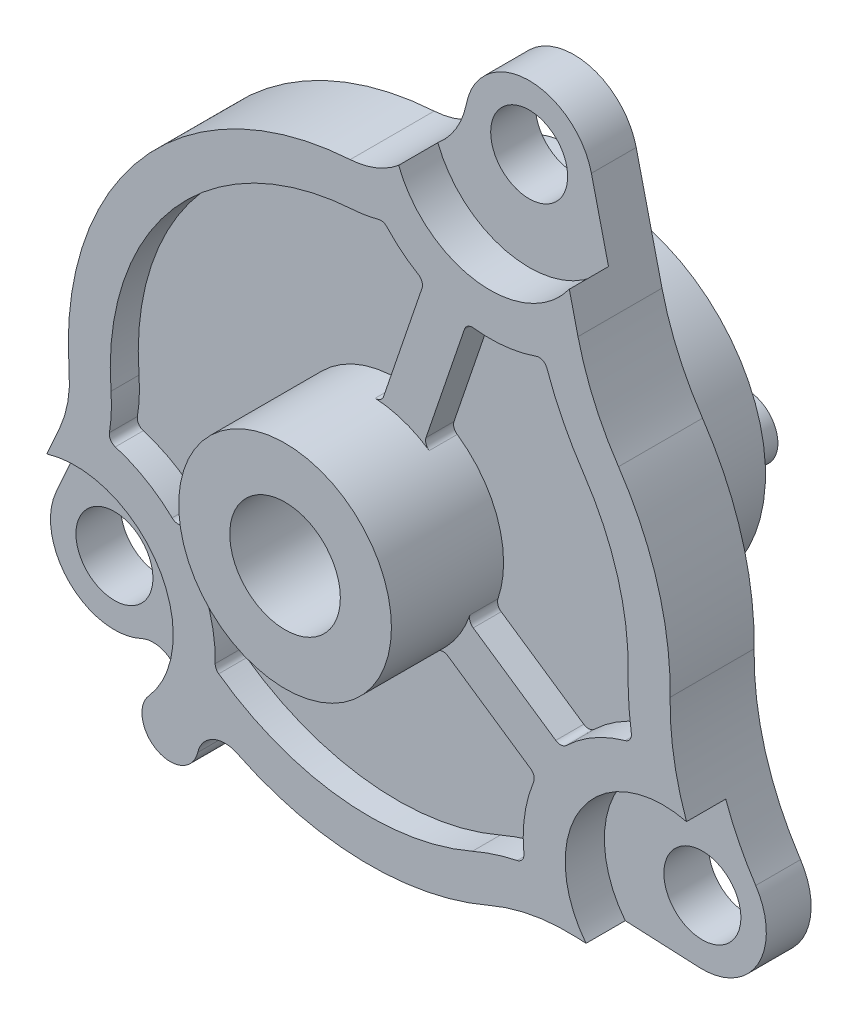
from build123d import *

# Parameters (mm, degrees)
EXTRUDE_START           = -5.08
EXTRUDE_1_OUTLINE_R     = 5.0165
EXTRUDE_1_DEPTH         = 5.08
EXTRUDE_1_2_OUTLINE_R   = 14.588011588
EXTRUDE_1_2_OUTLINE_R_2 = 2.268804718
EXTRUDE_1_2_OUTLINE_R_3 = 5.0165
EXTRUDE_1_2_OUTLINE_R_4 = 1.7
EXTRUDE_1_2_DEPTH       = 13.745
EXTRUDE_START_2         = -7.62
EXTRUDE_1_3_OUTLINE_R   = 5.0165
EXTRUDE_1_3_DEPTH       = 2.54
EXTRUDE_START_3         = -15.255
EXTRUDE_1_4_OUTLINE_R   = 9.652
EXTRUDE_1_4_OUTLINE_R_2 = 5.0165
EXTRUDE_1_4_DEPTH       = 7.635
EXTRUDE_START_4         = -4.064
EXTRUDE_1_5_OUTLINE_R   = 3.4925
EXTRUDE_1_5_DEPTH       = 4.064
SKETCH_2_R              = 3.139837575
SKETCH_2_R_2            = 1.7
EXTRUDE_2_DEPTH         = 13.745
SKETCH_3_R              = 1.2
CUT_EXTRUDE_1_DEPTH     = 2
SKETCH_4_R              = 2.8
SKETCH_4_R_2            = 1.7
EXTRUDE_3_DEPTH         = 3
SKETCH_5_R              = 1.7
SKETCH_5_R_2            = 1.2
EXTRUDE_4_DEPTH         = 5
EXTRUDE_5_DEPTH         = 2


with BuildPart() as part:
    # 凸台-拉伸1: read off the stored shape, not the designer's step
    # 凸台-拉伸1 outline → 凸台-拉伸1 (new body)
    with BuildSketch(Plane(origin=(0, 0, 0), x_dir=(-1, 0, 0), z_dir=(0, 0, -1)).offset(EXTRUDE_START)):
        with BuildLine():
            ThreePointArc((20.001041548, -24.024868384), (19.189851545, -13.342229592), (29.241937464, -9.636508412))
            Line((29.241937464, -9.636508412), (28.068905544, -6.994505511))
            ThreePointArc((28.068905544, -6.994505511), (27.342210837, -4.596155707), (27.224673499, -2.092887453))
            ThreePointArc((27.224673499, -2.092887453), (20.610396453, 17.910180989), (1.725707135, 27.250412105))
            ThreePointArc((1.725707135, 27.250412105), (-0.612060573, 27.775940536), (-2.671053319, 29.001455474))
            ThreePointArc((-2.671053319, 29.001455474), (-9.820841475, 23.407165066), (-18.154679086, 27.007540952))
            Line((-18.154679086, 27.007540952), (-18.943472312, 23.673588932))
            ThreePointArc((-18.943472312, 23.673588932), (-20.401103388, 19.31706117), (-22.619598737, 15.294338102))
            ThreePointArc((-22.619598737, 15.294338102), (-26.177171365, 7.766513011), (-27.300719551, -0.483463539))
            ThreePointArc((-27.300719551, -0.483463539), (-27.635164342, -5.065694963), (-28.789587413, -9.512717058))
            ThreePointArc((-28.789587413, -9.512717058), (-19.201342403, -13.324384855), (-19.674042111, -23.631654559))
            Line((-19.674042111, -23.631654559), (-18.789002246, -23.590560073))
            ThreePointArc((-18.789002246, -23.590560073), (-14.751162948, -23.864172006), (-10.879801534, -25.043820467))
            ThreePointArc((-10.879801534, -25.043820467), (0.599616353, -27.298415434), (11.968964894, -24.54194174))
            ThreePointArc((11.968964894, -24.54194174), (14.170803819, -24.529943899), (15.554698359, -26.242566013))
            ThreePointArc((15.554698359, -26.242566013), (18.332802908, -28.204355062), (20.616984936, -25.68463412))
            ThreePointArc((20.616984936, -25.68463412), (20.463088042, -24.797573692), (20.001041548, -24.024868384))
        make_face()
        Circle(EXTRUDE_1_OUTLINE_R, mode=Mode.SUBTRACT)
    extrude(amount=EXTRUDE_1_DEPTH)

    # Extrude 1 2 outline → Extrude 1 2 (add)
    with BuildSketch(Plane(origin=(0, 0, 0), x_dir=(-1, 0, 0), z_dir=(0, 0, -1))):
        Circle(EXTRUDE_1_2_OUTLINE_R)
        with Locations((-9.916654285, 0)):
            Circle(EXTRUDE_1_2_OUTLINE_R_2, mode=Mode.SUBTRACT)
        Circle(EXTRUDE_1_2_OUTLINE_R_3, mode=Mode.SUBTRACT)
        with Locations((9.916654285, 0)):
            Circle(EXTRUDE_1_2_OUTLINE_R_4, mode=Mode.SUBTRACT)
    extrude(amount=EXTRUDE_1_2_DEPTH)

    # Extrude 1 3 outline → Extrude 1 3 (add)
    with BuildSketch(Plane(origin=(0, 0, 0), x_dir=(-1, 0, 0), z_dir=(0, 0, -1)).offset(EXTRUDE_START_2)):
        with BuildLine():
            ThreePointArc((20.001041548, -24.024868384), (19.189851545, -13.342229592), (29.241937464, -9.636508412))
            Line((29.241937464, -9.636508412), (28.068905544, -6.994505511))
            ThreePointArc((28.068905544, -6.994505511), (27.342210837, -4.596155707), (27.224673499, -2.092887453))
            ThreePointArc((27.224673499, -2.092887453), (20.610396453, 17.910180989), (1.725707135, 27.250412105))
            ThreePointArc((1.725707135, 27.250412105), (-0.612060573, 27.775940536), (-2.671053319, 29.001455474))
            ThreePointArc((-2.671053319, 29.001455474), (-9.820841475, 23.407165066), (-18.154679086, 27.007540952))
            Line((-18.154679086, 27.007540952), (-18.943472312, 23.673588932))
            ThreePointArc((-18.943472312, 23.673588932), (-20.401103388, 19.31706117), (-22.619598737, 15.294338102))
            ThreePointArc((-22.619598737, 15.294338102), (-26.177171365, 7.766513011), (-27.300719551, -0.483463539))
            ThreePointArc((-27.300719551, -0.483463539), (-27.635164342, -5.065694963), (-28.789587413, -9.512717058))
            ThreePointArc((-28.789587413, -9.512717058), (-19.201342403, -13.324384855), (-19.674042111, -23.631654559))
            Line((-19.674042111, -23.631654559), (-18.789002246, -23.590560073))
            ThreePointArc((-18.789002246, -23.590560073), (-14.751162948, -23.864172006), (-10.879801534, -25.043820467))
            ThreePointArc((-10.879801534, -25.043820467), (0.599616353, -27.298415434), (11.968964894, -24.54194174))
            ThreePointArc((11.968964894, -24.54194174), (14.170803819, -24.529943899), (15.554698359, -26.242566013))
            ThreePointArc((15.554698359, -26.242566013), (18.332802908, -28.204355062), (20.616984936, -25.68463412))
            ThreePointArc((20.616984936, -25.68463412), (20.463088042, -24.797573692), (20.001041548, -24.024868384))
        make_face()
        with BuildLine():
            Line((-9.437411967, -3.963488283), (-16.925432177, -9.058357516))
            ThreePointArc((-16.925432177, -9.058357516), (-17.41757272, -9.187708174), (-17.881401777, -8.978432009))
            ThreePointArc((-17.881401777, -8.978432009), (-20.369392498, -7.119448331), (-23.234189867, -5.919925851))
            ThreePointArc((-23.234189867, -5.919925851), (-23.66657971, -5.602168652), (-23.782330153, -5.07821021))
            ThreePointArc((-23.782330153, -5.07821021), (-23.543476187, -2.752933566), (-23.491316823, -0.41600351))
            ThreePointArc((-23.491316823, -0.41600351), (-22.524542802, 6.682813521), (-19.463375657, 13.160244413))
            ThreePointArc((-19.463375657, 13.160244413), (-17.583975546, 16.360762601), (-16.125595223, 19.773765426))
            ThreePointArc((-16.125595223, 19.773765426), (-15.736516696, 20.206674843), (-15.155334867, 20.23861769))
            ThreePointArc((-15.155334867, 20.23861769), (-12.339759376, 19.599936809), (-9.452686504, 19.613679036))
            ThreePointArc((-9.452686504, 19.613679036), (-8.956292025, 19.50175751), (-8.641029977, 19.102328233))
            Line((-8.641029977, 19.102328233), (-5.153233585, 8.844103551))
            ThreePointArc((-5.153233585, 8.844103551), (-5.151801591, 8.357776579), (-5.444820191, 7.96963218))
            ThreePointArc((-5.444820191, 7.96963218), (-9.153474063, 3.061864885), (-9.144158429, -3.089574506))
            ThreePointArc((-9.144158429, -3.089574506), (-9.143653777, -3.575903324), (-9.437411967, -3.963488283))
        make_face(mode=Mode.SUBTRACT)
        with BuildLine():
            ThreePointArc((-7.151258866, -7.323488283), (-6.682895498, -7.19252367), (-6.230707221, -7.371525726))
            ThreePointArc((-6.230707221, -7.371525726), (0, -9.652), (6.230707221, -7.371525726))
            ThreePointArc((6.230707221, -7.371525726), (6.682895498, -7.19252367), (7.151258866, -7.323488283))
            Line((7.151258866, -7.323488283), (14.639279076, -12.418357516))
            ThreePointArc((14.639279076, -12.418357516), (14.940264662, -12.828652024), (14.91587299, -13.336922575))
            ThreePointArc((14.91587299, -13.336922575), (14.177670379, -15.859049125), (13.97436048, -18.4791122))
            ThreePointArc((13.97436048, -18.4791122), (13.89467208, -18.838860561), (13.655503297, -19.119159362))
            ThreePointArc((13.655503297, -19.119159362), (2.466910188, -23.365131695), (-9.361689692, -21.54933389))
            ThreePointArc((-9.361689692, -21.54933389), (-11.36623515, -20.794349539), (-13.435727078, -20.241713106))
            ThreePointArc((-13.435727078, -20.241713106), (-13.891836222, -19.945284024), (-14.034051192, -19.420231022))
            ThreePointArc((-14.034051192, -19.420231022), (-14.101364036, -16.324420921), (-14.91587299, -13.336922575))
            ThreePointArc((-14.91587299, -13.336922575), (-14.940264662, -12.828652024), (-14.639279076, -12.418357516))
            Line((-14.639279076, -12.418357516), (-7.151258866, -7.323488283))
        make_face(mode=Mode.SUBTRACT)
        with BuildLine():
            Line((16.925432177, -9.058357516), (9.437411967, -3.963488283))
            ThreePointArc((9.437411967, -3.963488283), (9.143653777, -3.575903324), (9.144158429, -3.089574506))
            ThreePointArc((9.144158429, -3.089574506), (7.680637088, 5.845418541), (-0.541368686, 9.636805692))
            ThreePointArc((-0.541368686, 9.636805692), (-1.010249862, 9.765904167), (-1.30554915, 10.152316259))
            Line((-1.30554915, 10.152316259), (-4.793345542, 20.410540941))
            ThreePointArc((-4.793345542, 20.410540941), (-4.786886375, 20.919355432), (-4.461586411, 21.310653068))
            ThreePointArc((-4.461586411, 21.310653068), (-2.953099663, 22.36336928), (-1.612513688, 23.62296165))
            ThreePointArc((-1.612513688, 23.62296165), (-1.26105352, 23.839608177), (-0.848188408, 23.841146693))
            ThreePointArc((-0.848188408, 23.841146693), (0.308161985, 23.584056969), (1.484910791, 23.44802902))
            ThreePointArc((1.484910791, 23.44802902), (17.73452718, 15.411085967), (23.425881848, -1.800856645))
            ThreePointArc((23.425881848, -1.800856645), (23.397483591, -3.467160777), (23.567714628, -5.124989875))
            ThreePointArc((23.567714628, -5.124989875), (23.461621487, -5.65215236), (23.033860973, -5.978000458))
            ThreePointArc((23.033860973, -5.978000458), (20.279055523, -7.17155875), (17.881401777, -8.978432009))
            ThreePointArc((17.881401777, -8.978432009), (17.41757272, -9.187708174), (16.925432177, -9.058357516))
        make_face(mode=Mode.SUBTRACT)
        Circle(EXTRUDE_1_3_OUTLINE_R, mode=Mode.SUBTRACT)
    extrude(amount=EXTRUDE_1_3_DEPTH)

    # Extrude 1 4 outline → Extrude 1 4 (add)
    with BuildSketch(Plane(origin=(0, 0, 0), x_dir=(-1, 0, 0), z_dir=(0, 0, -1)).offset(EXTRUDE_START_3)):
        Circle(EXTRUDE_1_4_OUTLINE_R)
        Circle(EXTRUDE_1_4_OUTLINE_R_2, mode=Mode.SUBTRACT)
    extrude(amount=EXTRUDE_1_4_DEPTH)

    # Extrude 1 5 outline → Extrude 1 5 (add)
    # profile 1 of 3: a face of its own
    with BuildSketch(Plane(origin=(0, 0, 0), x_dir=(-1, 0, 0), z_dir=(0, 0, -1)).offset(EXTRUDE_START_4)):
        with BuildLine():
            Line((31.974558392, -15.791151184), (29.241937464, -9.636508412))
            ThreePointArc((29.241937464, -9.636508412), (19.189851545, -13.342229592), (20.001041548, -24.024868384))
            ThreePointArc((20.001041548, -24.024868384), (20.463088042, -24.797573692), (20.616984936, -25.68463412))
            ThreePointArc((20.616984936, -25.68463412), (21.802856471, -23.565523811), (24.226273175, -23.410697217))
            ThreePointArc((24.226273175, -23.410697217), (30.739454478, -22.284551863), (31.974558392, -15.791151184))
        make_face()
        with Locations((26.67, -18.146340237)):
            Circle(EXTRUDE_1_5_OUTLINE_R, mode=Mode.SUBTRACT)
    # profile 2 of 3: a face of its own
    with BuildSketch(Plane(origin=(0, 0, 0), x_dir=(-1, 0, 0), z_dir=(0, 0, -1)).offset(EXTRUDE_START_4)):
        with BuildLine():
            ThreePointArc((-18.154679086, 27.007540952), (-9.820841475, 23.407165066), (-2.671053319, 29.001455474))
            ThreePointArc((-2.671053319, 29.001455474), (-4.34154767, 30.95941179), (-5.264931729, 33.361807717))
            ThreePointArc((-5.264931729, 33.361807717), (-10.854529977, 38.027365143), (-16.604256141, 33.560634381))
            Line((-16.604256141, 33.560634381), (-18.154679086, 27.007540952))
        make_face()
        with Locations((-10.956281429, 32.224357143)):
            Circle(EXTRUDE_1_5_OUTLINE_R, mode=Mode.SUBTRACT)
    # profile 3 of 3: a face of its own
    with BuildSketch(Plane(origin=(0, 0, 0), x_dir=(-1, 0, 0), z_dir=(0, 0, -1)).offset(EXTRUDE_START_4)):
        with BuildLine():
            Line((-26.400801283, -23.943993837), (-19.674042111, -23.631654559))
            ThreePointArc((-19.674042111, -23.631654559), (-19.201342403, -13.324384855), (-28.789587413, -9.512717058))
            ThreePointArc((-28.789587413, -9.512717058), (-29.987271524, -12.310373526), (-31.510952034, -14.944709618))
            ThreePointArc((-31.510952034, -14.944709618), (-31.716980405, -21.01221602), (-26.400801283, -23.943993837))
        make_face()
        with Locations((-26.67, -18.146340237)):
            Circle(EXTRUDE_1_5_OUTLINE_R, mode=Mode.SUBTRACT)
    extrude(amount=EXTRUDE_1_5_DEPTH)

    # 草图2 → 凸台-拉伸2 (add)
    with BuildSketch(Plane(origin=(0, 0, 0), x_dir=(-1, 0, 0), z_dir=(0, 0, -1))):
        with Locations((-9.916654285, 0)):
            Circle(SKETCH_2_R)
        with Locations(Location((-9.916654285, 0, 0), (0, 0, 180))):
            Circle(SKETCH_2_R_2, mode=Mode.SUBTRACT)
    extrude(amount=EXTRUDE_2_DEPTH)

    # 草图3 → 切除-拉伸1 (cut)
    with BuildSketch(Plane(origin=(0, 0, -13.745), x_dir=(-1, 0, 0), z_dir=(0, 0, -1))):
        with Locations((8.32907413, -5.382058747)):
            Circle(SKETCH_3_R)
        with Locations(Location((8.32907413, 5.382058747, 0), (0, 0, 180))):
            Circle(SKETCH_3_R)
    cut_extrude_1 = extrude(amount=-CUT_EXTRUDE_1_DEPTH, mode=Mode.SUBTRACT)

    # 草图4 → 凸台-拉伸3 (add)
    with BuildSketch(Plane(origin=(0, 0, -13.745), x_dir=(-1, 0, 0), z_dir=(0, 0, -1))):
        with Locations(Location((9.916654285, 0, 0), (0, 0, 180))):
            Circle(SKETCH_4_R)
        with Locations(Location((9.916654285, 0, 0), (0, 0, 180))):
            Circle(SKETCH_4_R_2, mode=Mode.SUBTRACT)
    extrude_3 = extrude(amount=EXTRUDE_3_DEPTH)

    # 镜向1: 切除-拉伸1, 凸台-拉伸3 across plane
    add(cut_extrude_1.mirror(Plane(origin=(0, 0, 0), x_dir=(0, 0, 1), z_dir=(1, 0, 0))), mode=Mode.SUBTRACT)
    add(extrude_3.mirror(Plane(origin=(0, 0, 0), x_dir=(0, 0, 1), z_dir=(1, 0, 0))))

    # 草图5 → 凸台-拉伸4 (add)
    with BuildSketch(Plane(origin=(0, 0, -16.745), x_dir=(-1, 0, 0), z_dir=(0, 0, -1))):
        with Locations(Location((9.916654285, 0, 0), (0, 0, 180))):
            Circle(SKETCH_5_R)
        with Locations((8.32907413, -5.382058747)):
            Circle(SKETCH_5_R_2)
        with Locations((8.32907413, 5.382058747)):
            Circle(SKETCH_5_R_2)
    extrude(amount=-EXTRUDE_4_DEPTH)

    # 草图6 → 凸台-拉伸5 (add)
    with BuildSketch(Plane(origin=(0, 0, -16.745), x_dir=(-1, 0, 0), z_dir=(0, 0, -1))):
        with BuildLine():
            ThreePointArc((13.858476779, -8.955033298), (16.5, 0), (13.858476779, 8.955033298))
            ThreePointArc((13.858476779, 8.955033298), (7.815185626, 11.945317039), (2.310952159, 8.050887844))
            ThreePointArc((2.310952159, 8.050887844), (2.152954051, 6.068219054), (3.269835625, 4.422462548))
            ThreePointArc((3.269835625, 4.422462548), (5.5, 0), (3.269835625, -4.422462548))
            ThreePointArc((3.269835625, -4.422462548), (2.152954051, -6.068219054), (2.310952159, -8.050887844))
            ThreePointArc((2.310952159, -8.050887844), (7.815185626, -11.945317039), (13.858476779, -8.955033298))
        make_face()
    extrude(amount=EXTRUDE_5_DEPTH)


solid = part.part
